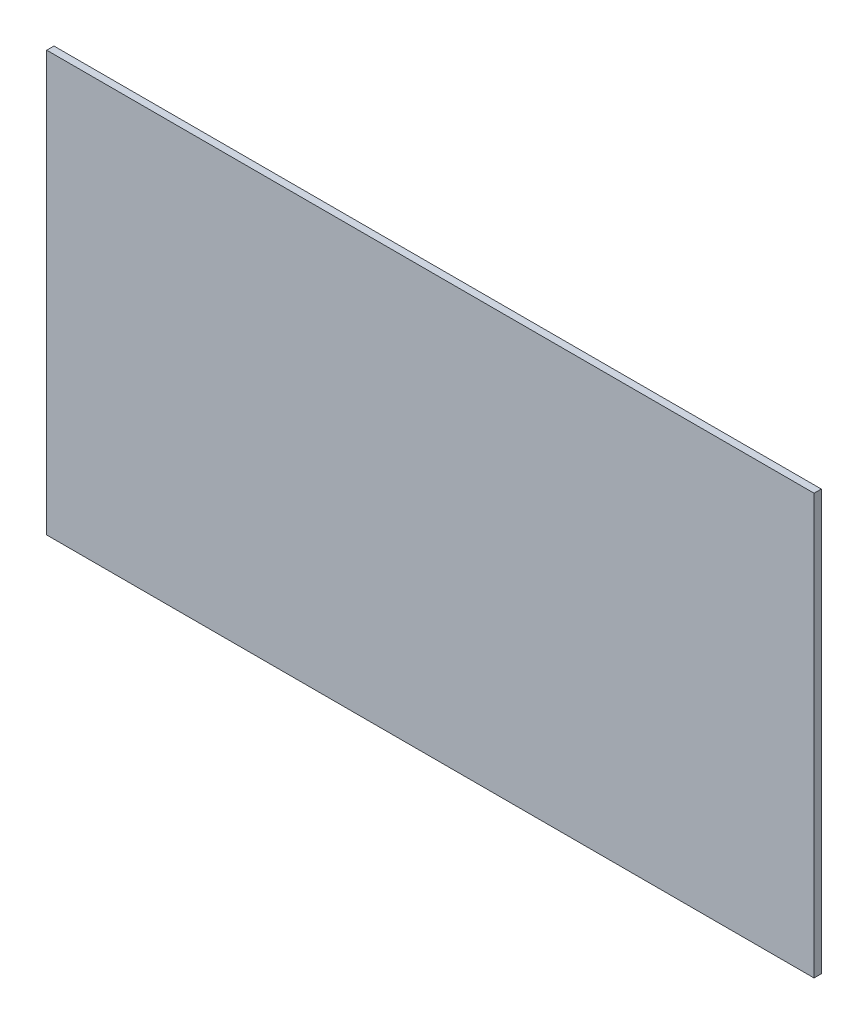
from build123d import *

# Parameters (mm, degrees)
SKETCH1_W           = 13.462
SKETCH1_H           = 7.366
BOSS_EXTRUDE1_DEPTH = 0.127


with BuildPart() as part:
    # Sketch1 → Boss-Extrude1 (new body)
    with BuildSketch(Plane.XY):
        with Locations((71.800681464, 114.580869701)):
            Rectangle(SKETCH1_W, SKETCH1_H)
    extrude(amount=BOSS_EXTRUDE1_DEPTH)


solid = part.part
